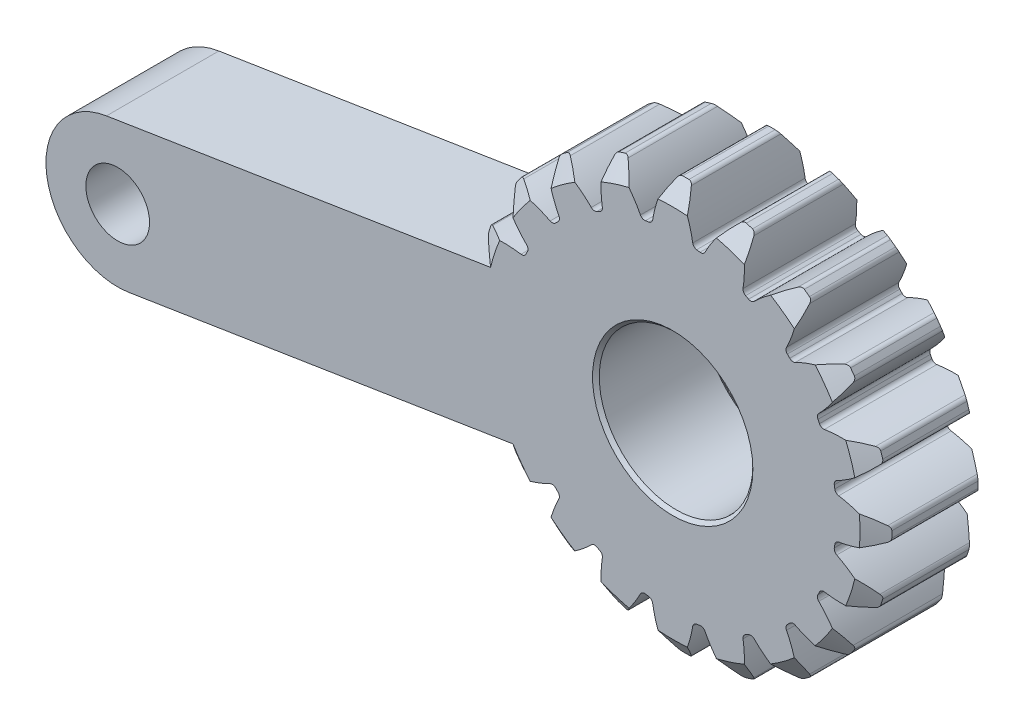
from build123d import *

# Parameters (mm, degrees)
SKETCH_11_R                            = 8.75
EXTRUDE_A_DEPTH                        = 6
EXTRUDE_START                          = -6
EXTRUDE_B_DEPTH                        = 6
FILLET_1149_R                          = 0.25
PATTERN_CIRCULAR_1474_COUNT            = 20
FILLET_1149_OF_PATTERN_CIRCULAR_1474_R = 0.25
SKETCH_4_R                             = 12
SKETCH_4_R_2                           = 10
CUT_EXTRUDE_6209_DEPTH                 = 1
CUT_EXTRUDE_6209_DRAFT                 = -55
CUT_EXTRUDE_START                      = -6
SKETCH_4_2_R                           = 12
SKETCH_4_2_R_2                         = 10
CUT_EXTRUDE_2_DEPTH                    = 1
CUT_EXTRUDE_2_DRAFT                    = 55
SKETCH_13_R                            = 4.1
CUT_EXTRUDE_4_DEPTH                    = 17.673332168
CHAMFER_1_SIZE                         = 0.18
EXTRUDE_1_REACH                        = 18.673
SKETCH_15_R                            = 1.7


with BuildPart() as part:
    # 草图11 → 拉伸-齿轮a (new body)
    with BuildSketch(Plane(origin=(-11.8785, -4, 0), x_dir=(1, 0, 0), z_dir=(0, 0, 1))):
        with Locations((11.8785, 4)):
            Circle(SKETCH_11_R)
    extrude(amount=-EXTRUDE_A_DEPTH)

    # 草图3 → 拉伸-齿轮b (add)
    with BuildSketch(Plane(origin=(-1.36106, -4, 0), x_dir=(1, 0, 0), z_dir=(0, 0, 1)).offset(EXTRUDE_START)):
        with BuildLine():
            ThreePointArc((10.042063636, 2.903334206), (10.11106, 4), (10.042063636, 5.096665794))
            ThreePointArc((10.042063636, 5.096665794), (11.237023581, 4.81690867), (12.356574121, 4.314116559))
            ThreePointArc((12.356574121, 4.314116559), (12.36106, 4), (12.356574121, 3.685883441))
            ThreePointArc((12.356574121, 3.685883441), (11.237023581, 3.18309133), (10.042063636, 2.903334206))
        make_face()
    extrude_b = extrude(amount=EXTRUDE_B_DEPTH)

    # Fillet 1149
    fillet_1149_edges = [part.edges().sort_by_distance(p)[0] for p in [
        (10.995514121, -0.314116559, -3),
        (8.681003637, -1.096665794, -3),
        (8.681003637, 1.096665794, -3),
        (10.995514121, 0.314116559, -3),
    ]]
    fillet(fillet_1149_edges, radius=FILLET_1149_R)

    # Pattern Circular 1474: 拉伸-齿轮b ×20 about axis
    pattern_circular_1474_axis = Axis((0, 0, 0), (0, 0, 1))
    for i in range(1, PATTERN_CIRCULAR_1474_COUNT):
        add(extrude_b.rotate(pattern_circular_1474_axis, i * 360 / PATTERN_CIRCULAR_1474_COUNT))

    # Fillet 1149 of Pattern Circular 1474
    fillet_1149_of_pattern_circular_1474_edges = [part.edges().sort_by_distance(p)[0] for p in [
        (10.55442271, 3.099058125, -3),
        (8.595013444, 1.639586503, -3),
        (7.917236709, 3.725568801, -3),
        (10.360288, 3.696543325, -3),
        (9.080190867, 6.208875408, -3),
        (7.66768345, 4.215344648, -3),
        (6.37847549, 5.989787177, -3),
        (8.710924705, 6.717126676, -3),
        (6.717126676, 8.710924705, -3),
        (5.989787177, 6.37847549, -3),
        (4.215344648, 7.66768345, -3),
        (6.208875408, 9.080190867, -3),
        (3.696543325, 10.360288, -3),
        (3.725568801, 7.917236709, -3),
        (1.639586503, 8.595013444, -3),
        (3.099058125, 10.55442271, -3),
        (0.314116559, 10.995514121, -3),
        (1.096665794, 8.681003637, -3),
        (-1.096665794, 8.681003637, -3),
        (-0.314116559, 10.995514121, -3),
        (-3.099058125, 10.55442271, -3),
        (-1.639586503, 8.595013444, -3),
        (-3.725568801, 7.917236709, -3),
        (-3.696543325, 10.360288, -3),
        (-6.208875408, 9.080190867, -3),
        (-4.215344648, 7.66768345, -3),
        (-5.989787177, 6.37847549, -3),
        (-6.717126676, 8.710924705, -3),
        (-8.710924705, 6.717126676, -3),
        (-6.37847549, 5.989787177, -3),
        (-7.66768345, 4.215344648, -3),
        (-9.080190867, 6.208875408, -3),
        (-10.360288, 3.696543325, -3),
        (-7.917236709, 3.725568801, -3),
        (-8.595013444, 1.639586503, -3),
        (-10.55442271, 3.099058125, -3),
        (-10.995514121, 0.314116559, -3),
        (-8.681003637, 1.096665794, -3),
        (-8.681003637, -1.096665794, -3),
        (-10.995514121, -0.314116559, -3),
        (-10.55442271, -3.099058125, -3),
        (-8.595013444, -1.639586503, -3),
        (-7.917236709, -3.725568801, -3),
        (-10.360288, -3.696543325, -3),
        (-9.080190867, -6.208875408, -3),
        (-7.66768345, -4.215344648, -3),
        (-6.37847549, -5.989787177, -3),
        (-8.710924705, -6.717126676, -3),
        (-6.717126676, -8.710924705, -3),
        (-5.989787177, -6.37847549, -3),
        (-4.215344648, -7.66768345, -3),
        (-6.208875408, -9.080190867, -3),
        (-3.696543325, -10.360288, -3),
        (-3.725568801, -7.917236709, -3),
        (-1.639586503, -8.595013444, -3),
        (-3.099058125, -10.55442271, -3),
        (-0.314116559, -10.995514121, -3),
        (-1.096665794, -8.681003637, -3),
        (1.096665794, -8.681003637, -3),
        (0.314116559, -10.995514121, -3),
        (3.099058125, -10.55442271, -3),
        (1.639586503, -8.595013444, -3),
        (3.725568801, -7.917236709, -3),
        (3.696543325, -10.360288, -3),
        (6.208875408, -9.080190867, -3),
        (4.215344648, -7.66768345, -3),
        (5.989787177, -6.37847549, -3),
        (6.717126676, -8.710924705, -3),
        (8.710924705, -6.717126676, -3),
        (6.37847549, -5.989787177, -3),
        (7.66768345, -4.215344648, -3),
        (9.080190867, -6.208875408, -3),
        (10.360288, -3.696543325, -3),
        (7.917236709, -3.725568801, -3),
        (8.595013444, -1.639586503, -3),
        (10.55442271, -3.099058125, -3),
    ]]
    fillet(fillet_1149_of_pattern_circular_1474_edges, radius=FILLET_1149_OF_PATTERN_CIRCULAR_1474_R)


with BuildPart() as cut_extrude_6209_tool:
    # 草图4 → Cut-Extrude 6209 (with draft: the straight prism first)
    with BuildSketch(Plane(origin=(0, 0, -6), x_dir=(-1, 0, 0), z_dir=(0, 0, -1))):
        Circle(SKETCH_4_R)
        Circle(SKETCH_4_R_2, mode=Mode.SUBTRACT)
    extrude(amount=-CUT_EXTRUDE_6209_DEPTH)
    # Cut-Extrude 6209: the draft: its side faces are tilted about the plane it starts from
    cut_extrude_6209_sides = [cut_extrude_6209_tool.faces().sort_by_distance(p)[0] for p in [
        (12, 0, -5.5),
        (10, 0, -5.5),
    ]]
    draft(cut_extrude_6209_sides, Plane(origin=(0, 0, -6), x_dir=(-1, 0, 0), z_dir=(0, 0, -1)), CUT_EXTRUDE_6209_DRAFT)


with BuildPart() as part_1:
    add(part.part)

    # Cut-Extrude 6209: cut by cut_extrude_6209_tool
    add(cut_extrude_6209_tool.part, mode=Mode.SUBTRACT)


with BuildPart() as cut_extrude_2_tool:
    # 草图4<2> → 切除-拉伸2 (with draft: the straight prism first)
    with BuildSketch(Plane(origin=(0, 0, -6), x_dir=(-1, 0, 0), z_dir=(0, 0, -1)).offset(CUT_EXTRUDE_START)):
        Circle(SKETCH_4_2_R)
        Circle(SKETCH_4_2_R_2, mode=Mode.SUBTRACT)
    extrude(amount=CUT_EXTRUDE_2_DEPTH)
    # 切除-拉伸2: the draft: its side faces are tilted about the plane it starts from
    cut_extrude_2_sides = [cut_extrude_2_tool.faces().sort_by_distance(p)[0] for p in [
        (12, 0, -0.5),
        (10, 0, -0.5),
    ]]
    draft(cut_extrude_2_sides, Plane(origin=(0, 0, -6), x_dir=(-1, 0, 0), z_dir=(0, 0, -1)).offset(CUT_EXTRUDE_START), CUT_EXTRUDE_2_DRAFT)


with BuildPart() as part_2:
    add(part_1.part)

    # 切除-拉伸2: cut by cut_extrude_2_tool
    add(cut_extrude_2_tool.part, mode=Mode.SUBTRACT)

    # 草图13 → 切除-拉伸4 (cut, through all)
    with BuildSketch(Plane.XY):
        Circle(SKETCH_13_R)
    extrude(amount=-CUT_EXTRUDE_4_DEPTH, mode=Mode.SUBTRACT)

    # 倒角1
    chamfer_1_edges = [part_2.edges().sort_by_distance(p)[0] for p in [
        (-4.1, 0, -6),
        (-4.1, 0, 0),
    ]]
    chamfer(chamfer_1_edges, length=CHAMFER_1_SIZE)

    # 凸台-拉伸1: up to this face of the body (flat: up to its plane)
    extrude_1_end = Plane(part_2.part.faces().sort_by_distance((-4.562842715, 0, -6))[0])
    # 草图15 → 凸台-拉伸1 (add, up to the picked face)
    with BuildSketch(Plane.XY, mode=Mode.PRIVATE) as extrude_1_sk1:
        with BuildLine():
            Line((-8.353543205, -5.200021312), (-29.031628492, -8.475108277))
            ThreePointArc((-29.031628492, -8.475108277), (-33.412724544, -5.292055677), (-30.229671943, -0.910959625))
            Line((-30.229671943, -0.910959625), (-9.551586656, 2.36412734))
            Line((-9.551586656, 2.36412734), (-4.693044943, -0.146768701))
            Line((-4.693044943, -0.146768701), (-8.353543205, -5.200021312))
        make_face()
        with Locations((-29.630650218, -4.693033951)):
            Circle(SKETCH_15_R, mode=Mode.SUBTRACT)
    extrude_1_tool1 = split(extrude(extrude_1_sk1.sketch, amount=-EXTRUDE_1_REACH, mode=Mode.PRIVATE), bisect_by=extrude_1_end, keep=Keep.BOTH, mode=Mode.PRIVATE)
    add(extrude_1_tool1.solids().sort_by(Axis((-19.201874, -3.023729, 0), (0, 0, -1)))[0])


solid = part_2.part
